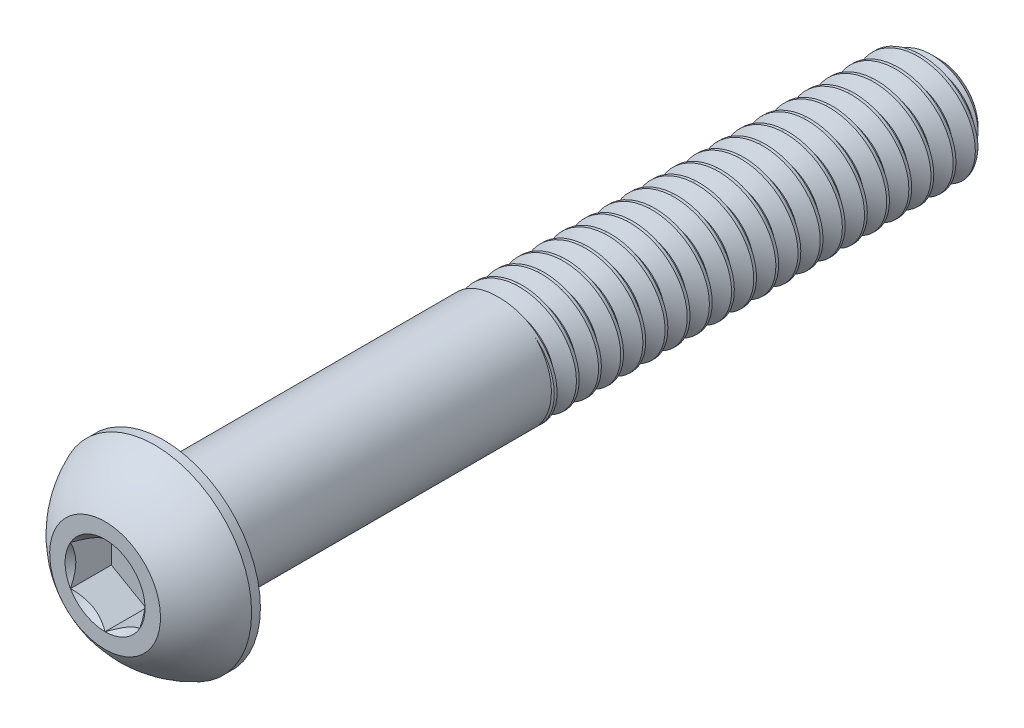
from build123d import *
from build123d.topology import SkipClean

# Parameters (mm, degrees)
SKETCH1_W           = 44.45
SKETCH1_H           = 3.175
CHAMFER1_SIZE       = 0.9525
CUT_SWEEP1_PITCH    = 1.27
CUT_EXTRUDE2_DEPTH  = 2.34696
BOSS_EXTRUDE2_START = -19.05
SKETCH9_R           = 3.175
BOSS_EXTRUDE2_DEPTH = 19.05


with BuildPart() as part:
    # Sketch1 → Revolve1 (revolve)
    with BuildSketch(Plane(origin=(0, 0, 0), x_dir=(0, 0, -1), z_dir=(1, 0, 0))):
        with Locations((25.5778, 1.5875)):
            Rectangle(SKETCH1_W, SKETCH1_H)
    revolve(axis=Axis((0, 0, -47.8028), (0, 0, 1)))

    # Chamfer1
    chamfer1_edges = [part.edges().sort_by_distance(p)[0] for p in [
        (0, -3.175, -47.8028),
    ]]
    chamfer(chamfer1_edges, length=CHAMFER1_SIZE)

    # Cut-Sweep1: arcs per turn and ends read off the stored shape
    # Cut-Sweep1: the profile of Sketch2 profile screwed along a right-hand helix through 36 turns, 8 arcs to a turn; built about Z, then put on its axis
    cut_sweep1_z = Axis((0, 0, 0), (0, 0, 1))
    cut_sweep1_corners = [(3.1753, 0, 0.000173205), (3.1753, 0, -1.111423205), (2.350110803, 0, -0.635), (2.350110803, 0, -0.47625)]
    with BuildLine(mode=Mode.PRIVATE) as cut_sweep1_profile:
        Line(cut_sweep1_corners[0], cut_sweep1_corners[1])
        Line(cut_sweep1_corners[1], cut_sweep1_corners[2])
        Line(cut_sweep1_corners[2], cut_sweep1_corners[3])
        Line(cut_sweep1_corners[3], cut_sweep1_corners[0])
    cut_sweep1_cap = Face(cut_sweep1_profile.wire())
    cut_sweep1_turn_angles = [0, 22.5, 45, 67.5, 90, 112.5, 135, 157.5, 180, 202.5, 225, 247.5, 270, 292.5, 315, 337.5, 360]
    cut_sweep1_turn_weights = [1, 0.9238795325112867, 1, 0.9238795325112867, 1, 0.9238795325112867, 1, 0.9238795325112867, 1, 0.9238795325112867, 1, 0.9238795325112867, 1, 0.9238795325112867, 1, 0.9238795325112867, 1]
    cut_sweep1_turn_rails = [Edge.make_bspline([Vector(p[0], p[1], 0).rotate(cut_sweep1_z, cut_sweep1_turn_angles[k]) / cut_sweep1_turn_weights[k] + Vector(0, 0, p[2] + CUT_SWEEP1_PITCH * cut_sweep1_turn_angles[k] / 360) for k in range(17)], [0, 0, 0, 1, 1, 2, 2, 3, 3, 4, 4, 5, 5, 6, 6, 7, 7, 8, 8, 8], 2, cut_sweep1_turn_weights) for p in cut_sweep1_corners]
    cut_sweep1_turn_sides = [Face.make_surface_from_curves(cut_sweep1_turn_rails[p[0]], cut_sweep1_turn_rails[p[1]]) for p in [(0, 1), (1, 2), (2, 3), (3, 0)]]
    cut_sweep1 = Plane(origin=(0, 0, -47.8028), x_dir=(0, 1, 0), z_dir=(0, 0, 1)) * Solid(Shell([*[p.moved(Location((0, 0, CUT_SWEEP1_PITCH * i))) for i in range(36) for p in cut_sweep1_turn_sides], cut_sweep1_cap, cut_sweep1_cap.rotate(cut_sweep1_z, 12960).moved(Location((0, 0, CUT_SWEEP1_PITCH * 12960 / 360)))]))
    add(cut_sweep1, mode=Mode.SUBTRACT)

    # Sketch7 → Revolve2 (revolve)
    with BuildSketch(Plane(origin=(0, 0, 0), x_dir=(0, 0, -1), z_dir=(1, 0, 0)), mode=Mode.PRIVATE) as revolve2_sk:
        with BuildLine():
            Line((2.84988, 5.5499), (3.3528, 5.5499))
            Line((3.3528, 5.5499), (3.3528, 0))
            Line((3.3528, 0), (0, 0))
            Line((0, 0), (0, 3.175))
            ThreePointArc((0, 3.175), (1.235921075, 4.58927271), (2.84988, 5.5499))
        make_face()
    revolve(revolve2_sk.sketch.rotate(Axis((0, 0, 0), (0, 0, -1)), 189.052465709), axis=Axis((0, 0, 0), (0, 0, -1)))

    # Sketch5 → Cut-Extrude2 (cut)
    with BuildSketch(Plane.XY):
        Polygon((1.984375, -1.14567944), (1.984375, 1.14567944), (0, 2.291358881), (-1.984375, 1.14567944), (-1.984375, -1.14567944), (0, -2.291358881), align=None)
    extrude(amount=-CUT_EXTRUDE2_DEPTH, mode=Mode.SUBTRACT)

    # Cut-Extrude3 cone 1 section (through the dimple's axis) → Cut-Extrude3 (revolve, cut)
    with BuildSketch(Plane(origin=(0, 0, 0), x_dir=(0, -1, 0), z_dir=(1, 0, 0))):
        Polygon((0, 0), (2.291358881, 0), (0, 2.291358881), align=None)
    revolve(axis=Axis((0, 0, 0), (0, 0, -1)), mode=Mode.SUBTRACT)

    # Sketch9 → Boss-Extrude2 (add)
    with SkipClean():  # the faces are left unmerged after this step: merging them gives an invalid solid
        with BuildSketch(Plane.XY.offset(-3.3528).offset(BOSS_EXTRUDE2_START)):
            with Locations(Location((0, 0, 0), (0, 0, 90))):
                Circle(SKETCH9_R)
        extrude(amount=BOSS_EXTRUDE2_DEPTH)


solid = part.part
